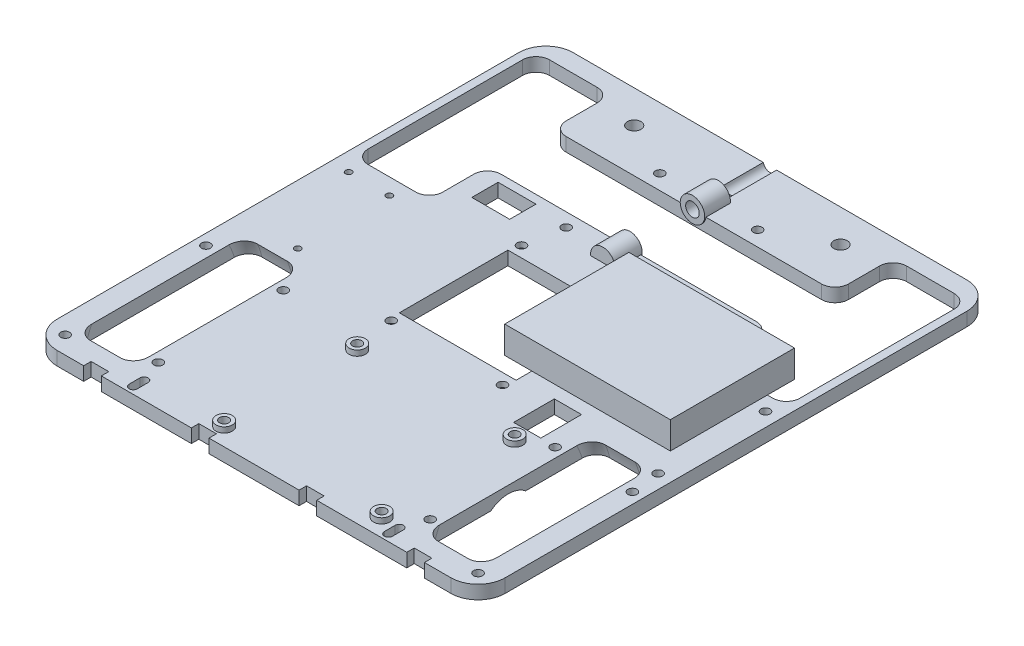
from build123d import *

# Parameters (mm, degrees)
SKIZZE1_W                            = 165
SKIZZE1_H                            = 190
GRUNDPLATTE_DEPTH                    = 5
SKIZZE2_R                            = 3
AUFSATZ_PI_HALTERUNG_DEPTH           = 2
SKIZZE3_R                            = 1.7
L_CHER_PI_HALTERUNG_DEPTH            = 4
SKIZZE4_W                            = 43
SKIZZE4_H                            = 40
AUSSCHNITT_F_R_KAMERABOX_DEPTH       = 127.016863951
SKIZZE5_R                            = 1.7
SCHNITT_LINEAR_AUSTRAGEN1_DEPTH      = 4
AUFSATZ_LINEAR_START                 = -61.05
AUFSATZ_LINEAR_AUSTRAGEN1_OUTLINE_R  = 4.5
AUFSATZ_LINEAR_AUSTRAGEN1_DEPTH      = 42
SCHNITT_LINEAR_START                 = -42
SCHNITT_LINEAR_AUSTRAGEN2_DEPTH      = 61.05
SKIZZE8_W                            = 145
SKIZZE8_H                            = 24
SCHNITT_LINEAR_AUSTRAGEN3_DEPTH      = 126.921602595
SCHNITT_LINEAR_START_2               = -18
SKIZZE11_R                           = 33.401730924
SCHNITT_LINEAR_AUSTRAGEN5_DEPTH      = 21
SKIZZE13_R                           = 33.401730924
SCHNITT_LINEAR_AUSTRAGEN6_DEPTH      = 21
SCHNITT_LINEAR_AUSTRAGEN7_DEPTH      = 126.921602595
SCHNITT_LINEAR_AUSTRAGEN7_DEPTH_BACK = 126.921602595
SKIZZE14_W                           = 9
SKIZZE14_H                           = 23
SKIZZE18_W                           = 27.5
SKIZZE18_H                           = 66.803187974
SCHNITT_LINEAR_AUSTRAGEN8_DEPTH      = 126.921602595
VERRUNDUNG1_R                        = 10
VERRUNDUNG2_R                        = 5
SKIZZE19_W                           = 6.5
SKIZZE19_H                           = 2.75
SCHNITT_LINEAR_AUSTRAGEN9_DEPTH      = 126.92160274
SKIZZE20_R                           = 10.25
SCHNITT_LINEAR_AUSTRAGEN10_DEPTH     = 107.1
SKIZZE22_W                           = 6
SKIZZE22_H                           = 20
SKIZZE22_W_2                         = 17.9
AUFSATZ_LINEAR_AUSTRAGEN3_DEPTH      = 5
SKIZZE24_R                           = 1.15
SCHNITT_LINEAR_AUSTRAGEN12_DEPTH     = 126.92160274
SKIZZE25_R                           = 4.5
AUFSATZ_LINEAR_AUSTRAGEN4_DEPTH      = 0.5
SCHNITT_LINEAR_AUSTRAGEN13_DEPTH     = 126.92160274
SKIZZE29_R                           = 1.65
SCHNITT_LINEAR_AUSTRAGEN14_DEPTH     = 127.219055754
SKIZZE31_R                           = 1.65
SCHNITT_LINEAR_AUSTRAGEN15_DEPTH     = 127.219055754
AUFSATZ_LINEAR_START_2               = 10
SKIZZE32_W                           = 61
SKIZZE32_H                           = 45.730311682
AUFSATZ_LINEAR_AUSTRAGEN5_DEPTH      = 10
SKIZZE33_R                           = 1.65
SCHNITT_LINEAR_AUSTRAGEN16_DEPTH     = 129.281916245
SKIZZE35_W                           = 13.95
SKIZZE35_H                           = 9.675
SCHNITT_LINEAR_AUSTRAGEN18_DEPTH     = 128.401923202
SKIZZE36_R                           = 1.7
SCHNITT_LINEAR_AUSTRAGEN19_DEPTH     = 4
SKIZZE37_R                           = 1.15
SCHNITT_LINEAR_AUSTRAGEN20_DEPTH     = 129.281916245
AUFSATZ_LINEAR_AUSTRAGEN6_DEPTH      = 7
AUFSATZ_LINEAR_AUSTRAGEN6_DEPTH_BACK = 0.5
AUFSATZ_LINEAR_AUSTRAGEN6_START      = 23.5
SKIZZE38_R                           = 4.5
SKIZZE38_R_2                         = 2.5
SKIZZE39_W                           = 12
SKIZZE39_H                           = 15
SCHNITT_LINEAR_AUSTRAGEN21_DEPTH     = 128.401923202
SKIZZE40_W                           = 10
SKIZZE40_H                           = 15
SCHNITT_LINEAR_AUSTRAGEN22_DEPTH     = 128.401923202
SKIZZE41_R                           = 2.5
SCHNITT_LINEAR_AUSTRAGEN23_DEPTH     = 3
SKIZZE42_R                           = 2.5
SCHNITT_LINEAR_AUSTRAGEN24_DEPTH     = 129.281916245


# Read off the part's stored shape, not the designer's step: Aufsatz-Linear austragen1, Schnitt-Linear austragen2
with BuildPart() as part:
    # Skizze1 → Grundplatte (new body)
    with BuildSketch(Plane(origin=(0, 0, 0), x_dir=(1, 0, 0), z_dir=(0, 1, 0))):
        Rectangle(SKIZZE1_W, SKIZZE1_H)
    extrude(amount=GRUNDPLATTE_DEPTH)

    # Skizze2 → Aufsatz Pi Halterung (add)
    with BuildSketch(Plane(origin=(0, 5, 0), x_dir=(1, 0, 0), z_dir=(0, 1, 0))):
        with Locations(Location((-17.5, -39.5, 0), (0, 0, 270))):
            Circle(SKIZZE2_R)
        with Locations(Location((40.5, -39.5, 0), (0, 0, 270))):
            Circle(SKIZZE2_R)
        with Locations(Location((40.5, -88.5, 0), (0, 0, 270))):
            Circle(SKIZZE2_R)
        with Locations(Location((-17.5, -88.5, 0), (0, 0, 270))):
            Circle(SKIZZE2_R)
    extrude(amount=AUFSATZ_PI_HALTERUNG_DEPTH)

    # Skizze3 → Löcher Pi Halterung (cut)
    with BuildSketch(Plane(origin=(0, 7, 0), x_dir=(1, 0, 0), z_dir=(0, 1, 0))):
        with Locations(Location((-17.5, -39.5, 0), (0, 0, 270))):
            Circle(SKIZZE3_R)
        with Locations(Location((-17.5, -88.5, 0), (0, 0, 90))):
            Circle(SKIZZE3_R)
        with Locations(Location((40.5, -88.5, 0), (0, 0, 270))):
            Circle(SKIZZE3_R)
        with Locations(Location((40.5, -39.5, 0), (0, 0, 90))):
            Circle(SKIZZE3_R)
    extrude(amount=-L_CHER_PI_HALTERUNG_DEPTH, mode=Mode.SUBTRACT)

    # Skizze4 → Ausschnitt für Kamerabox (cut, through all)
    with BuildSketch(Plane(origin=(0, 0, 0), x_dir=(-1, 0, 0), z_dir=(0, -1, 0))):
        Rectangle(SKIZZE4_W, SKIZZE4_H)
    extrude(amount=-AUSSCHNITT_F_R_KAMERABOX_DEPTH, mode=Mode.SUBTRACT)

    # Skizze5 → Schnitt-Linear austragen1 (cut)
    with BuildSketch(Plane(origin=(0, 0, 0), x_dir=(-1, 0, 0), z_dir=(0, -1, 0))):
        with Locations(Location((49.95, -68.95, 0), (0, 0, 90))):
            Circle(SKIZZE5_R)
        with Locations(Location((49.95, -40.95, 0), (0, 0, 270))):
            Circle(SKIZZE5_R)
        with Locations(Location((12.95, -40.95, 0), (0, 0, 90))):
            Circle(SKIZZE5_R)
        with Locations(Location((12.95, -68.95, 0), (0, 0, 270))):
            Circle(SKIZZE5_R)
        with Locations(Location((-12.95, -68.95, 0), (0, 0, 90))):
            Circle(SKIZZE5_R)
        with Locations(Location((-12.95, -40.95, 0), (0, 0, 270))):
            Circle(SKIZZE5_R)
        with Locations(Location((-49.95, -40.95, 0), (0, 0, 90))):
            Circle(SKIZZE5_R)
        with Locations(Location((-49.95, -68.95, 0), (0, 0, 270))):
            Circle(SKIZZE5_R)
    extrude(amount=-SCHNITT_LINEAR_AUSTRAGEN1_DEPTH, mode=Mode.SUBTRACT)


with BuildPart() as body_2:
    # Aufsatz-Linear austragen1 outline → Aufsatz-Linear austragen1 (new body)
    with BuildSketch(Plane(origin=(0, 0, -95), x_dir=(-1, 0, 0), z_dir=(0, 0, -1)).offset(AUFSATZ_LINEAR_START)):
        with Locations((0, 5.5)):
            Circle(AUFSATZ_LINEAR_AUSTRAGEN1_OUTLINE_R)
    extrude(amount=AUFSATZ_LINEAR_AUSTRAGEN1_DEPTH)


with BuildPart() as schnitt_linear_austragen2_tool:
    # Schnitt-Linear austragen2 outline → Schnitt-Linear austragen2 (new body)
    with BuildSketch(Plane(origin=(0, 0, -75.95), x_dir=(-1, 0, 0), z_dir=(0, 0, -1)).offset(SCHNITT_LINEAR_START)):
        with BuildLine():
            ThreePointArc((2.449489743, 5), (0, 8), (-2.449489743, 5))
            ThreePointArc((-2.449489743, 5), (0, 3), (2.449489743, 5))
        make_face()
    extrude(amount=SCHNITT_LINEAR_AUSTRAGEN2_DEPTH)


with BuildPart() as part_1:
    add(part.part)

    # Schnitt-Linear austragen2: cut by schnitt_linear_austragen2_tool
    add(schnitt_linear_austragen2_tool.part, mode=Mode.SUBTRACT)

    # Skizze8 → Schnitt-Linear austragen3 (cut, through all)
    with BuildSketch(Plane(origin=(0, 5, 0), x_dir=(1, 0, 0), z_dir=(0, 1, 0))):
        with Locations((0, 54.95)):
            Rectangle(SKIZZE8_W, SKIZZE8_H)
    extrude(amount=-SCHNITT_LINEAR_AUSTRAGEN3_DEPTH, mode=Mode.SUBTRACT)

    # Skizze11 → Schnitt-Linear austragen5 (cut)
    with BuildSketch(Plane(origin=(71.55, 0, 0), x_dir=(0, 0, -1), z_dir=(1, 0, 0)).offset(SCHNITT_LINEAR_START_2)):
        with Locations((-54.95, -8)):
            Circle(SKIZZE11_R)
    extrude(amount=SCHNITT_LINEAR_AUSTRAGEN5_DEPTH, mode=Mode.SUBTRACT)

    # Skizze13 → Schnitt-Linear austragen6 (cut)
    with BuildSketch(Plane.ZY.offset(71.55).offset(SCHNITT_LINEAR_START_2)):
        with Locations((54.95, -8)):
            Circle(SKIZZE13_R)
    extrude(amount=SCHNITT_LINEAR_AUSTRAGEN6_DEPTH, mode=Mode.SUBTRACT)

    # Skizze18 → Schnitt-Linear austragen8 (cut, through all)
    with BuildSketch(Plane(origin=(0, 5, 0), x_dir=(1, 0, 0), z_dir=(0, 1, 0))):
        with Locations((-65.75, 54.95)):
            Rectangle(SKIZZE18_W, SKIZZE18_H)
        with Locations((65.75, 54.95)):
            Rectangle(SKIZZE18_W, SKIZZE18_H)
    extrude(amount=-SCHNITT_LINEAR_AUSTRAGEN8_DEPTH, mode=Mode.SUBTRACT)

    # Verrundung1
    verrundung1_edges = [part_1.edges().sort_by_distance(p)[0] for p in [
        (-82.5, 2.5, -95),
        (82.5, 2.5, -95),
        (82.5, 2.5, 95),
        (-82.5, 2.5, 95),
    ]]
    fillet(verrundung1_edges, radius=VERRUNDUNG1_R)

    # Verrundung2
    verrundung2_edges = [part_1.edges().sort_by_distance(p)[0] for p in [
        (74.55, 2.532811004, 86.64756333),
        (74.55, 2.532811004, 23.25243667),
        (53.55, 2.532811004, 86.64756333),
        (53.55, 2.532811004, 23.25243667),
        (-74.55, 2.532811004, 23.25243667),
        (-74.55, 2.532811004, 86.64756333),
        (-53.55, 2.532811004, 23.25243667),
        (-53.55, 2.532811004, 86.64756333),
        (52, 2.5, -42.95),
        (-52, 2.5, -42.95),
        (-52, 2.5, -66.95),
        (-52, 2.5, -88.351593987),
        (-79.5, 2.5, -21.548406013),
        (-79.5, 2.5, -88.351593987),
        (-52, 2.5, -21.548406013),
        (52, 2.5, -66.95),
        (52, 2.5, -21.548406013),
        (52, 2.5, -88.351593987),
        (79.5, 2.5, -88.351593987),
        (79.5, 2.5, -21.548406013),
    ]]
    fillet(verrundung2_edges, radius=VERRUNDUNG2_R)

    # Skizze19 → Schnitt-Linear austragen9 (cut, through all)
    with BuildSketch(Plane(origin=(0, 5, 0), x_dir=(1, 0, 0), z_dir=(0, 1, 0))):
        with Locations((59.5, -93.625)):
            Rectangle(SKIZZE19_W, SKIZZE19_H)
        with Locations((-19.833333333, -93.625)):
            Rectangle(SKIZZE19_W, SKIZZE19_H)
        with Locations((19.833333333, -93.625)):
            Rectangle(SKIZZE19_W, SKIZZE19_H)
        with Locations((-59.5, -93.625)):
            Rectangle(SKIZZE19_W, SKIZZE19_H)
    extrude(amount=-SCHNITT_LINEAR_AUSTRAGEN9_DEPTH, mode=Mode.SUBTRACT)

    # Skizze20 → Schnitt-Linear austragen10 (cut)
    with BuildSketch(Plane.ZY.offset(53.55)):
        with Locations((54.95, -8)):
            Circle(SKIZZE20_R)
    extrude(amount=-SCHNITT_LINEAR_AUSTRAGEN10_DEPTH, mode=Mode.SUBTRACT)

    # Skizze22 → Aufsatz-Linear austragen3 (add)
    with BuildSketch(Plane(origin=(0, 0, 0), x_dir=(-1, 0, 0), z_dir=(0, -1, 0))):
        with Locations((-39.2, -54.95)):
            Rectangle(SKIZZE22_W, SKIZZE22_H)
        with Locations((-23.7, -54.95)):
            Rectangle(SKIZZE22_W, SKIZZE22_H)
        with Locations((23.7, -54.95)):
            Rectangle(SKIZZE22_W, SKIZZE22_H)
        with Locations((39.2, -54.95)):
            Rectangle(SKIZZE22_W, SKIZZE22_H)
        with Locations((0, -54.95)):
            Rectangle(SKIZZE22_W_2, SKIZZE22_H)
    extrude(amount=-AUFSATZ_LINEAR_AUSTRAGEN3_DEPTH)

    # Skizze24 → Schnitt-Linear austragen12 (cut, through all)
    with BuildSketch(Plane(origin=(0, 5, 0), x_dir=(1, 0, 0), z_dir=(0, 1, 0))):
        with Locations(Location((0, 79.45, 0), (0, 0, 270))):
            Circle(SKIZZE24_R)
    extrude(amount=-SCHNITT_LINEAR_AUSTRAGEN12_DEPTH, mode=Mode.SUBTRACT)



with BuildPart() as body_2_1:
    add(body_2.part)

    # Schnitt-Linear austragen2: cut by schnitt_linear_austragen2_tool
    add(schnitt_linear_austragen2_tool.part, mode=Mode.SUBTRACT)

    # Skizze14 → Schnitt-Linear austragen7 (cut, two sides: drawn at the far end of the back side and taken through both)
    with BuildSketch(Plane(origin=(0, 5, 0), x_dir=(1, 0, 0), z_dir=(0, 1, 0)).offset(-SCHNITT_LINEAR_AUSTRAGEN7_DEPTH_BACK)):
        with Locations((0, 54.95)):
            Rectangle(SKIZZE14_W, SKIZZE14_H)
    extrude(amount=SCHNITT_LINEAR_AUSTRAGEN7_DEPTH + SCHNITT_LINEAR_AUSTRAGEN7_DEPTH_BACK, mode=Mode.SUBTRACT)


with BuildPart() as schnitt_linear_austragen7_piece_1:
    # of the separate pieces the step leaves, piece 1, a body of its own (schnitt_linear_austragen7_pieces)
    add(body_2_1.part.solids().sort_by_distance((-4.5, 5.5, -33.95))[0])


with BuildPart() as schnitt_linear_austragen7_piece_2:
    # of the separate pieces the step leaves, piece 2, a body of its own (schnitt_linear_austragen7_pieces)
    add(body_2_1.part.solids().sort_by_distance((-4.5, 5.5, -66.45))[0])


with BuildPart() as part_2:
    add(part_1.part)

    add(schnitt_linear_austragen7_piece_1.part)  # Aufsatz-Linear austragen4 merges Schnitt-Linear austragen7 piece 1
    # Skizze25 → Aufsatz-Linear austragen4 (add)
    with BuildSketch(Plane.XY.offset(-33.95)):
        with Locations(Location((0, 5.5, 0), (0, 0, 180))):
            Circle(SKIZZE25_R)
    extrude(amount=AUFSATZ_LINEAR_AUSTRAGEN4_DEPTH)

    # Skizze28 → Schnitt-Linear austragen13 (cut, through all)
    with BuildSketch(Plane(origin=(0, 5, 0), x_dir=(1, 0, 0), z_dir=(0, 1, 0))):
        with BuildLine():
            Line((48.5, -88.5), (48.5, -92.5))
            ThreePointArc((48.5, -92.5), (47, -94), (45.5, -92.5))
            Line((45.5, -92.5), (45.5, -88.5))
            ThreePointArc((45.5, -88.5), (47, -87), (48.5, -88.5))
        make_face()
        with BuildLine():
            Line((-48.5, -88.5), (-48.5, -92.5))
            ThreePointArc((-48.5, -92.5), (-47, -94), (-45.5, -92.5))
            Line((-45.5, -92.5), (-45.5, -88.5))
            ThreePointArc((-45.5, -88.5), (-47, -87), (-48.5, -88.5))
        make_face()
    extrude(amount=-SCHNITT_LINEAR_AUSTRAGEN13_DEPTH, mode=Mode.SUBTRACT)

    # Skizze29 → Schnitt-Linear austragen14 (cut, through all)
    with BuildSketch(Plane(origin=(0, 0, 0), x_dir=(-1, 0, 0), z_dir=(0, -1, 0))):
        with Locations(Location((-18, 72.45, 0), (0, 0, 90))):
            Circle(SKIZZE29_R)
        with Locations(Location((18, 72.45, 0), (0, 0, 270))):
            Circle(SKIZZE29_R)
        with Locations(Location((18, 37.95, 0), (0, 0, 90))):
            Circle(SKIZZE29_R)
        with Locations(Location((-18, 37.95, 0), (0, 0, 270))):
            Circle(SKIZZE29_R)
    extrude(amount=-SCHNITT_LINEAR_AUSTRAGEN14_DEPTH, mode=Mode.SUBTRACT)

    # Skizze31 → Schnitt-Linear austragen15 (cut, through all)
    with BuildSketch(Plane(origin=(0, 0, 0), x_dir=(-1, 0, 0), z_dir=(0, -1, 0))):
        with Locations(Location((50.05, -80.201897344, 0), (0, 0, 90))):
            Circle(SKIZZE31_R)
        with Locations(Location((76.035533906, -88.535533906, 0), (0, 0, 270))):
            Circle(SKIZZE31_R)
        with Locations(Location((50.05, -34.181905669, 0), (0, 0, 90))):
            Circle(SKIZZE31_R)
        with Locations(Location((78.525, -34.181905669, 0), (0, 0, 270))):
            Circle(SKIZZE31_R)
        with Locations(Location((-78.525, -34.181905669, 0), (0, 0, 90))):
            Circle(SKIZZE31_R)
        with Locations(Location((-50.05, -34.181905669, 0), (0, 0, 270))):
            Circle(SKIZZE31_R)
        with Locations(Location((-76.035533906, -88.535533906, 0), (0, 0, 90))):
            Circle(SKIZZE31_R)
        with Locations(Location((-50.05, -80.201897344, 0), (0, 0, 270))):
            Circle(SKIZZE31_R)
        with Locations(Location((-20.5, 24, 0), (0, 0, 90))):
            Circle(SKIZZE31_R)
        with Locations(Location((20.5, 24, 0), (0, 0, 270))):
            Circle(SKIZZE31_R)
        with Locations(Location((20.5, -24, 0), (0, 0, 90))):
            Circle(SKIZZE31_R)
        with Locations(Location((-20.5, -24, 0), (0, 0, 270))):
            Circle(SKIZZE31_R)
    extrude(amount=-SCHNITT_LINEAR_AUSTRAGEN15_DEPTH, mode=Mode.SUBTRACT)

    # Skizze33 → Schnitt-Linear austragen16 (cut, through all)
    with BuildSketch(Plane(origin=(0, 0, 0), x_dir=(-1, 0, 0), z_dir=(0, -1, 0))):
        with Locations(Location((-77.375, -23.566749828, 0), (0, 0, 90))):
            Circle(SKIZZE33_R)
        with Locations(Location((-29.625, 16.383250172, 0), (0, 0, 270))):
            Circle(SKIZZE33_R)
        with Locations(Location((-77.375, 15.983250172, 0), (0, 0, 270))):
            Circle(SKIZZE33_R)
    extrude(amount=-SCHNITT_LINEAR_AUSTRAGEN16_DEPTH, mode=Mode.SUBTRACT)

    # Skizze35 → Schnitt-Linear austragen18 (cut, through all)
    with BuildSketch(Plane(origin=(0, 5, 0), x_dir=(1, 0, 0), z_dir=(0, 1, 0))):
        with Locations((-37.975, 34.9875)):
            Rectangle(SKIZZE35_W, SKIZZE35_H)
    extrude(amount=-SCHNITT_LINEAR_AUSTRAGEN18_DEPTH, mode=Mode.SUBTRACT)

    # Skizze36 → Schnitt-Linear austragen19 (cut)
    with BuildSketch(Plane(origin=(0, 0, 0), x_dir=(-1, 0, 0), z_dir=(0, -1, 0))):
        with Locations(Location((30, 28.6, 0), (0, 0, 90))):
            Circle(SKIZZE36_R)
        with Locations(Location((30, -28.4, 0), (0, 0, 270))):
            Circle(SKIZZE36_R)
        with Locations(Location((-30, 28.6, 0), (0, 0, 90))):
            Circle(SKIZZE36_R)
        with Locations(Location((-30, -28.4, 0), (0, 0, 270))):
            Circle(SKIZZE36_R)
    extrude(amount=-SCHNITT_LINEAR_AUSTRAGEN19_DEPTH, mode=Mode.SUBTRACT)

    # Skizze37 → Schnitt-Linear austragen20 (cut, through all)
    with BuildSketch(Plane(origin=(0, 0, 0), x_dir=(-1, 0, 0), z_dir=(0, -1, 0))):
        with Locations(Location((75.711, 15.548406013, 0), (0, 0, 90))):
            Circle(SKIZZE37_R)
        with Locations(Location((60.711, 15.548406013, 0), (0, 0, 270))):
            Circle(SKIZZE37_R)
        with Locations(Location((60.711, -18.181905669, 0), (0, 0, 90))):
            Circle(SKIZZE37_R)
    extrude(amount=-SCHNITT_LINEAR_AUSTRAGEN20_DEPTH, mode=Mode.SUBTRACT)


    add(schnitt_linear_austragen7_piece_2.part)  # Aufsatz-Linear austragen6 merges Schnitt-Linear austragen7 piece 2
    # Skizze38 → Aufsatz-Linear austragen6 (add, two sides: drawn at the far end of the back side and taken through both)
    with BuildSketch(Plane(origin=(0, 0, -43.45), x_dir=(-1, 0, 0), z_dir=(0, 0, -1)).offset(AUFSATZ_LINEAR_AUSTRAGEN6_START - AUFSATZ_LINEAR_AUSTRAGEN6_DEPTH_BACK)):
        with Locations(Location((0, 5.5, 0), (0, 0, 186.379370208))):
            Circle(SKIZZE38_R)
        with Locations((0, 5.5)):
            Circle(SKIZZE38_R_2, mode=Mode.SUBTRACT)
    extrude(amount=AUFSATZ_LINEAR_AUSTRAGEN6_DEPTH + AUFSATZ_LINEAR_AUSTRAGEN6_DEPTH_BACK)

    # Skizze39 → Schnitt-Linear austragen21 (cut, through all)
    with BuildSketch(Plane(origin=(0, 5, 0), x_dir=(1, 0, 0), z_dir=(0, 1, 0))):
        with Locations((41, 30.45)):
            Rectangle(SKIZZE39_W, SKIZZE39_H)
    extrude(amount=-SCHNITT_LINEAR_AUSTRAGEN21_DEPTH, mode=Mode.SUBTRACT)

    # Skizze40 → Schnitt-Linear austragen22 (cut, through all)
    with BuildSketch(Plane(origin=(0, 5, 0), x_dir=(1, 0, 0), z_dir=(0, 1, 0))):
        with Locations((39.5, -26.4)):
            Rectangle(SKIZZE40_W, SKIZZE40_H)
    extrude(amount=-SCHNITT_LINEAR_AUSTRAGEN22_DEPTH, mode=Mode.SUBTRACT)

    # Skizze41 → Schnitt-Linear austragen23 (cut)
    with BuildSketch(Plane(origin=(0, 0, 0), x_dir=(-1, 0, 0), z_dir=(0, -1, 0))):
        with Locations(Location((20.5, -24, 0), (0, 0, 90))):
            Circle(SKIZZE41_R)
        with Locations(Location((-20.5, -24, 0), (0, 0, 270))):
            Circle(SKIZZE41_R)
        with Locations(Location((-20.5, 24, 0), (0, 0, 90))):
            Circle(SKIZZE41_R)
        with Locations(Location((20.5, 24, 0), (0, 0, 270))):
            Circle(SKIZZE41_R)
        with Locations(Location((-29.625, 16.383250172, 0), (0, 0, 270))):
            Circle(SKIZZE41_R)
    extrude(amount=-SCHNITT_LINEAR_AUSTRAGEN23_DEPTH, mode=Mode.SUBTRACT)

    # Skizze42 → Schnitt-Linear austragen24 (cut, through all)
    with BuildSketch(Plane(origin=(0, 0, 0), x_dir=(-1, 0, 0), z_dir=(0, -1, 0))):
        with Locations(Location((38, 83, 0), (0, 0, 90))):
            Circle(SKIZZE42_R)
        with Locations(Location((-38, 83, 0), (0, 0, 270))):
            Circle(SKIZZE42_R)
    extrude(amount=-SCHNITT_LINEAR_AUSTRAGEN24_DEPTH, mode=Mode.SUBTRACT)


with BuildPart() as body_3:
    # Skizze32 → Aufsatz-Linear austragen5 (new body)
    with BuildSketch(Plane(origin=(0, 5, 0), x_dir=(1, 0, 0), z_dir=(0, 1, 0)).offset(AUFSATZ_LINEAR_START_2)):
        with Locations((52, -1.316749828)):
            Rectangle(SKIZZE32_W, SKIZZE32_H)
    extrude(amount=AUFSATZ_LINEAR_AUSTRAGEN5_DEPTH)


solid = Compound([part_2.part, body_3.part])
